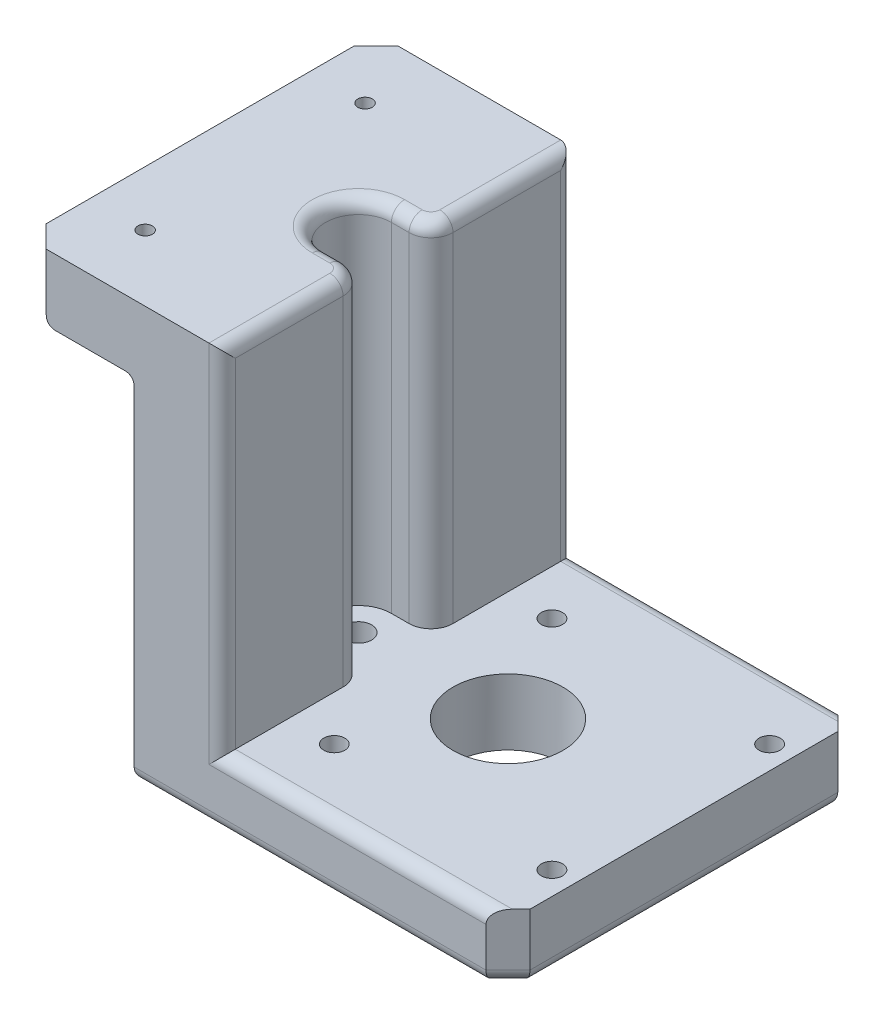
from build123d import *

# Parameters (mm, degrees)
SKETCH1_W           = 90
SKETCH1_H           = 80
BOSS_EXTRUDE1_DEPTH = 15
SKETCH2_R           = 7
CUT_EXTRUDE1_DEPTH  = 5
CHAMFER1_SIZE       = 5
SKETCH3_R           = 2.4
SKETCH3_R_2         = 12.5
SKETCH3_R_3         = 4.25
CUT_EXTRUDE2_DEPTH  = 20
SKETCH4_R           = 6.23126099
SKETCH4_R_2         = 3
BOSS_EXTRUDE2_DEPTH = 10
BOSS_EXTRUDE3_DEPTH = 60
SKETCH6_R           = 1.65
BOSS_EXTRUDE4_DEPTH = 20
CHAMFER2_SIZE       = 5
FILLET1_R           = 3


with BuildPart() as part:
    # Sketch1 → Boss-Extrude1 (new body)
    with BuildSketch(Plane(origin=(0, 0, 0), x_dir=(1, 0, 0), z_dir=(0, 1, 0))):
        with Locations((45, 40)):
            Rectangle(SKETCH1_W, SKETCH1_H)
    extrude(amount=BOSS_EXTRUDE1_DEPTH)

    # Sketch2 → Cut-Extrude1 (cut)
    with BuildSketch(Plane.XZ):
        with Locations(Location((16, -40, 0), (0, 0, 270))):
            Circle(SKETCH2_R)
    extrude(amount=-CUT_EXTRUDE1_DEPTH, mode=Mode.SUBTRACT)

    # Chamfer1
    chamfer1_edges = [part.edges().sort_by_distance(p)[0] for p in [
        (0, 7.5, -80),
        (90, 7.5, -80),
        (90, 7.5, 0),
        (0, 7.5, 0),
    ]]
    chamfer(chamfer1_edges, length=CHAMFER1_SIZE)

    # Sketch3 → Cut-Extrude2 (cut)
    with BuildSketch(Plane(origin=(0, 15, 0), x_dir=(1, 0, 0), z_dir=(0, 1, 0))):
        with Locations(Location((35.251262658, 64.748737342, 0), (0, 0, 270))):
            Circle(SKETCH3_R)
        with Locations(Location((84.748737342, 64.748737342, 0), (0, 0, 90))):
            Circle(SKETCH3_R)
        with Locations(Location((84.748737342, 15.251262658, 0), (0, 0, 270))):
            Circle(SKETCH3_R)
        with Locations(Location((35.251262658, 15.251262658, 0), (0, 0, 90))):
            Circle(SKETCH3_R)
        with Locations(Location((50, 40, 0), (0, 0, 270))):
            Circle(SKETCH3_R_2)
        with Locations(Location((16, 40, 0), (0, 0, 270))):
            Circle(SKETCH3_R_3)
    extrude(amount=-CUT_EXTRUDE2_DEPTH, mode=Mode.SUBTRACT)

    # Sketch4 → Boss-Extrude2 (add)
    with BuildSketch(Plane(origin=(0, 15, 0), x_dir=(1, 0, 0), z_dir=(0, 1, 0))):
        with Locations((16, 40)):
            Circle(SKETCH4_R)
        with Locations(Location((16, 40, 0), (0, 0, 270))):
            Circle(SKETCH4_R_2, mode=Mode.SUBTRACT)
    extrude(amount=-BOSS_EXTRUDE2_DEPTH)

    # Sketch5 → Boss-Extrude3 (add)
    with BuildSketch(Plane(origin=(0, 15, 0), x_dir=(1, 0, 0), z_dir=(0, 1, 0))):
        with BuildLine():
            Line((5, 0), (25, 0))
            Line((25, 0), (25, 27.5))
            ThreePointArc((25, 27.5), (23.535533906, 31.035533906), (20, 32.5))
            Line((20, 32.5), (16, 32.5))
            ThreePointArc((16, 32.5), (8.5, 40), (16, 47.5))
            Line((16, 47.5), (20, 47.5))
            ThreePointArc((20, 47.5), (23.535533906, 48.964466094), (25, 52.5))
            Line((25, 52.5), (25, 80))
            Line((25, 80), (5, 80))
            Line((5, 80), (0, 75))
            Line((0, 75), (0, 5))
            Line((0, 5), (5, 0))
        make_face()
    extrude(amount=BOSS_EXTRUDE3_DEPTH)

    # Sketch6 → Boss-Extrude4 (add)
    with BuildSketch(Plane(origin=(0, 75, 0), x_dir=(1, 0, 0), z_dir=(0, 1, 0))):
        with BuildLine():
            Line((5, 80), (-20, 80))
            Line((-20, 80), (-20, 0))
            Line((-20, 0), (5, 0))
            Line((5, 0), (25, 0))
            Line((25, 0), (25, 27.5))
            ThreePointArc((25, 27.5), (23.535533906, 31.035533906), (20, 32.5))
            Line((20, 32.5), (16, 32.5))
            ThreePointArc((16, 32.5), (8.5, 40), (16, 47.5))
            Line((16, 47.5), (20, 47.5))
            ThreePointArc((20, 47.5), (23.535533906, 48.964466094), (25, 52.5))
            Line((25, 52.5), (25, 80))
            Line((25, 80), (5, 80))
        make_face()
        with Locations(Location((-7.5, 65, 0), (0, 0, 270))):
            Circle(SKETCH6_R, mode=Mode.SUBTRACT)
        with Locations(Location((-7.5, 15, 0), (0, 0, 270))):
            Circle(SKETCH6_R, mode=Mode.SUBTRACT)
    extrude(amount=BOSS_EXTRUDE4_DEPTH)

    # Chamfer2
    chamfer2_edges = [part.edges().sort_by_distance(p)[0] for p in [
        (-20, 85, 0),
        (-7.5, 75, 0),
        (-20, 85, -80),
        (-7.5, 75, -80),
    ]]
    chamfer(chamfer2_edges, length=CHAMFER2_SIZE)

    # Fillet1
    # the kernel refuses this fillet: 3 mm, written as the material it adds along each edge
    with BuildSketch(Plane(origin=(7.5, 82.5, 2.5), x_dir=(-0.816496580927726, 0.40824829046386135, 0.4082482904638647), z_dir=(-0.5773502691896258, -0.5773502691896258, -0.5773502691896258))) as fillet1_piece_1_section:
        with BuildLine():
            CenterArc((FILLET1_R * 0.57735026919, -FILLET1_R), FILLET1_R, 90, 60)
            Line((-FILLET1_R * 0.288675134595, -FILLET1_R * 0.5), (0, 0))
            Line((0, 0), (FILLET1_R * 0.57735026919, 0))
        make_face()
    fillet1_piece_1 = extrude(amount=17.320508076, mode=Mode.PRIVATE)
    fillet1_piece_1 = split(fillet1_piece_1, bisect_by=Plane(origin=(2.443536035, 77.443536035, 0), z_dir=(0, 0, -1)), keep=Keep.TOP, mode=Mode.PRIVATE)
    fillet1_piece_1 = split(fillet1_piece_1, bisect_by=Plane(origin=(0, 77.443536035, -2.121242245), z_dir=(1, 0, 0)), keep=Keep.TOP, mode=Mode.PRIVATE)
    fillet1_piece_1 = split(fillet1_piece_1, bisect_by=Plane(origin=(2.443536035, 75, -2.121242245), z_dir=(0, 1, 0)), keep=Keep.TOP, mode=Mode.PRIVATE)
    add(fillet1_piece_1)
    with BuildSketch(Plane(origin=(7.5, 82.5, 2.5), x_dir=(-0.816496580927726, 0.40824829046386135, 0.4082482904638647), z_dir=(-0.5773502691896258, -0.5773502691896258, -0.5773502691896258))) as fillet1_piece_2_section:
        with BuildLine():
            CenterArc((FILLET1_R * 0.57735026919, -FILLET1_R), FILLET1_R, 90, 60)
            Line((-FILLET1_R * 0.288675134595, -FILLET1_R * 0.5), (0, 0))
            Line((0, 0), (FILLET1_R * 0.57735026919, 0))
        make_face()
    fillet1_piece_2 = extrude(amount=17.320508076, mode=Mode.PRIVATE)
    fillet1_piece_2 = split(fillet1_piece_2, bisect_by=Plane(origin=(0, 74.437654686, -4.39441922), z_dir=(1, 0, 0)), keep=Keep.TOP, mode=Mode.PRIVATE)
    fillet1_piece_2 = split(fillet1_piece_2, bisect_by=Plane(origin=(0.562345314, 75, -4.39441922), z_dir=(0, -1, 0)), keep=Keep.TOP, mode=Mode.PRIVATE)
    add(fillet1_piece_2)
    with BuildSketch(Plane(origin=(7.5, 82.5, 2.5), x_dir=(-0.816496580927726, 0.40824829046386135, 0.4082482904638647), z_dir=(-0.5773502691896258, -0.5773502691896258, -0.5773502691896258))) as fillet1_piece_3_section:
        with BuildLine():
            CenterArc((FILLET1_R * 0.57735026919, -FILLET1_R), FILLET1_R, 90, 60)
            Line((-FILLET1_R * 0.288675134595, -FILLET1_R * 0.5), (0, 0))
            Line((0, 0), (FILLET1_R * 0.57735026919, 0))
        make_face()
    fillet1_piece_3 = extrude(amount=17.320508076, mode=Mode.PRIVATE)
    fillet1_piece_3 = split(fillet1_piece_3, bisect_by=Plane(origin=(0, 75.562345314, -4.39441922), z_dir=(-1, 0, 0)), keep=Keep.TOP, mode=Mode.PRIVATE)
    fillet1_piece_3 = split(fillet1_piece_3, bisect_by=Plane(origin=(-0.562345314, 75, -4.39441922), z_dir=(0, 1, 0)), keep=Keep.TOP, mode=Mode.PRIVATE)
    add(fillet1_piece_3)
    with BuildSketch(Plane(origin=(7.5, 82.5, -82.5), x_dir=(0.40824829046386274, -0.816496580927726, -0.40824829046386324), z_dir=(-0.5773502691896258, -0.5773502691896258, 0.5773502691896258))) as fillet1_piece_4_section:
        with BuildLine():
            CenterArc((FILLET1_R * 0.57735026919, -FILLET1_R), FILLET1_R, 90, 60)
            Line((-FILLET1_R * 0.288675134595, -FILLET1_R * 0.5), (0, 0))
            Line((0, 0), (FILLET1_R * 0.57735026919, 0))
        make_face()
    fillet1_piece_4 = extrude(amount=17.320508076, mode=Mode.PRIVATE)
    fillet1_piece_4 = split(fillet1_piece_4, bisect_by=Plane(origin=(2.443536035, 77.443536035, -80), z_dir=(0, 0, 1)), keep=Keep.TOP, mode=Mode.PRIVATE)
    fillet1_piece_4 = split(fillet1_piece_4, bisect_by=Plane(origin=(0, 77.443536035, -77.878757755), z_dir=(1, 0, 0)), keep=Keep.TOP, mode=Mode.PRIVATE)
    fillet1_piece_4 = split(fillet1_piece_4, bisect_by=Plane(origin=(2.443536035, 75, -77.878757755), z_dir=(0, 1, 0)), keep=Keep.TOP, mode=Mode.PRIVATE)
    add(fillet1_piece_4)
    with BuildSketch(Plane(origin=(7.5, 82.5, -82.5), x_dir=(0.40824829046386274, -0.816496580927726, -0.40824829046386324), z_dir=(-0.5773502691896258, -0.5773502691896258, 0.5773502691896258))) as fillet1_piece_5_section:
        with BuildLine():
            CenterArc((FILLET1_R * 0.57735026919, -FILLET1_R), FILLET1_R, 90, 60)
            Line((-FILLET1_R * 0.288675134595, -FILLET1_R * 0.5), (0, 0))
            Line((0, 0), (FILLET1_R * 0.57735026919, 0))
        make_face()
    fillet1_piece_5 = extrude(amount=17.320508076, mode=Mode.PRIVATE)
    fillet1_piece_5 = split(fillet1_piece_5, bisect_by=Plane(origin=(0, 75.562345314, -75.60558078), z_dir=(-1, 0, 0)), keep=Keep.TOP, mode=Mode.PRIVATE)
    fillet1_piece_5 = split(fillet1_piece_5, bisect_by=Plane(origin=(-0.562345314, 75, -75.60558078), z_dir=(0, 1, 0)), keep=Keep.TOP, mode=Mode.PRIVATE)
    add(fillet1_piece_5)
    with BuildSketch(Plane(origin=(7.5, 82.5, -82.5), x_dir=(0.40824829046386274, -0.816496580927726, -0.40824829046386324), z_dir=(-0.5773502691896258, -0.5773502691896258, 0.5773502691896258))) as fillet1_piece_6_section:
        with BuildLine():
            CenterArc((FILLET1_R * 0.57735026919, -FILLET1_R), FILLET1_R, 90, 60)
            Line((-FILLET1_R * 0.288675134595, -FILLET1_R * 0.5), (0, 0))
            Line((0, 0), (FILLET1_R * 0.57735026919, 0))
        make_face()
    fillet1_piece_6 = extrude(amount=17.320508076, mode=Mode.PRIVATE)
    fillet1_piece_6 = split(fillet1_piece_6, bisect_by=Plane(origin=(0, 74.437654686, -75.60558078), z_dir=(1, 0, 0)), keep=Keep.TOP, mode=Mode.PRIVATE)
    fillet1_piece_6 = split(fillet1_piece_6, bisect_by=Plane(origin=(0.562345314, 75, -75.60558078), z_dir=(0, -1, 0)), keep=Keep.TOP, mode=Mode.PRIVATE)
    add(fillet1_piece_6)
    with BuildSketch(Plane(origin=(0, 75, -82.5), x_dir=(0, -1, 0), z_dir=(0, 0, 1))) as fillet1_piece_7_section:
        with BuildLine():
            CenterArc((FILLET1_R, -FILLET1_R), FILLET1_R, 90, 90)
            Line((0, -FILLET1_R), (0, 0))
            Line((0, 0), (FILLET1_R, 0))
        make_face()
    fillet1_piece_7 = extrude(amount=85, mode=Mode.PRIVATE)
    fillet1_piece_7 = split(fillet1_piece_7, bisect_by=Plane(origin=(-1.222323404, 74.871054126, -73.777676596), z_dir=(-0.7071067811865476, 0, -0.7071067811865476)), keep=Keep.TOP, mode=Mode.PRIVATE)
    fillet1_piece_7 = split(fillet1_piece_7, bisect_by=Plane(origin=(-1.586782581, 74.506594949, -74.506594949), z_dir=(0, 0.7071067811865476, 0.7071067811865476)), keep=Keep.TOP, mode=Mode.PRIVATE)
    add(fillet1_piece_7)
    with BuildSketch(Plane(origin=(0, 75, -82.5), x_dir=(0, -1, 0), z_dir=(0, 0, 1))) as fillet1_piece_8_section:
        with BuildLine():
            CenterArc((FILLET1_R, -FILLET1_R), FILLET1_R, 90, 90)
            Line((0, -FILLET1_R), (0, 0))
            Line((0, 0), (FILLET1_R, 0))
        make_face()
    fillet1_piece_8 = extrude(amount=85, mode=Mode.PRIVATE)
    fillet1_piece_8 = split(fillet1_piece_8, bisect_by=Plane(origin=(-0.493405051, 73.413217419, -74.506594949), z_dir=(0.7071067811865476, 0, 0.7071067811865476)), keep=Keep.TOP, mode=Mode.PRIVATE)
    fillet1_piece_8 = split(fillet1_piece_8, bisect_by=Plane(origin=(-0.128945874, 73.777676596, -73.777676596), z_dir=(0, -0.7071067811865476, -0.7071067811865476)), keep=Keep.TOP, mode=Mode.PRIVATE)
    add(fillet1_piece_8)
    with BuildSketch(Plane(origin=(0, 75, -82.5), x_dir=(0, -1, 0), z_dir=(0, 0, 1))) as fillet1_piece_9_section:
        with BuildLine():
            CenterArc((FILLET1_R, -FILLET1_R), FILLET1_R, 90, 90)
            Line((0, -FILLET1_R), (0, 0))
            Line((0, 0), (FILLET1_R, 0))
        make_face()
    fillet1_piece_9 = extrude(amount=85, mode=Mode.PRIVATE)
    fillet1_piece_9 = split(fillet1_piece_9, bisect_by=Plane(origin=(-17.837124827, 74.325750345, -57.162875173), z_dir=(0.7071067811865476, 0, 0.7071067811865476)), keep=Keep.TOP, mode=Mode.PRIVATE)
    fillet1_piece_9 = split(fillet1_piece_9, bisect_by=Plane(origin=(-17.837124827, 74.325750345, -22.837124827), z_dir=(0.7071067811865476, 0, -0.7071067811865476)), keep=Keep.TOP, mode=Mode.PRIVATE)
    fillet1_piece_9 = split(fillet1_piece_9, bisect_by=Plane(origin=(-0.674249655, 57.162875173, -57.162875173), z_dir=(0, 0.7071067811865476, 0.7071067811865476)), keep=Keep.TOP, mode=Mode.PRIVATE)
    fillet1_piece_9 = split(fillet1_piece_9, bisect_by=Plane(origin=(-0.674249655, 57.162875173, -22.837124827), z_dir=(0, 0.7071067811865476, -0.7071067811865476)), keep=Keep.TOP, mode=Mode.PRIVATE)
    add(fillet1_piece_9)
    with BuildSketch(Plane(origin=(0, 75, -82.5), x_dir=(0, -1, 0), z_dir=(0, 0, 1))) as fillet1_piece_10_section:
        with BuildLine():
            CenterArc((FILLET1_R, -FILLET1_R), FILLET1_R, 90, 90)
            Line((0, -FILLET1_R), (0, 0))
            Line((0, 0), (FILLET1_R, 0))
        make_face()
    fillet1_piece_10 = extrude(amount=85, mode=Mode.PRIVATE)
    fillet1_piece_10 = split(fillet1_piece_10, bisect_by=Plane(origin=(-1.222323404, 74.871054126, -6.222323404), z_dir=(-0.7071067811865476, 0, 0.7071067811865476)), keep=Keep.TOP, mode=Mode.PRIVATE)
    fillet1_piece_10 = split(fillet1_piece_10, bisect_by=Plane(origin=(-1.586782581, 74.506594949, -5.493405051), z_dir=(0, 0.7071067811865476, -0.7071067811865476)), keep=Keep.TOP, mode=Mode.PRIVATE)
    add(fillet1_piece_10)
    with BuildSketch(Plane(origin=(0, 75, -82.5), x_dir=(0, -1, 0), z_dir=(0, 0, 1))) as fillet1_piece_11_section:
        with BuildLine():
            CenterArc((FILLET1_R, -FILLET1_R), FILLET1_R, 90, 90)
            Line((0, -FILLET1_R), (0, 0))
            Line((0, 0), (FILLET1_R, 0))
        make_face()
    fillet1_piece_11 = extrude(amount=85, mode=Mode.PRIVATE)
    fillet1_piece_11 = split(fillet1_piece_11, bisect_by=Plane(origin=(-0.493405051, 73.413217419, -5.493405051), z_dir=(0.7071067811865476, 0, -0.7071067811865476)), keep=Keep.TOP, mode=Mode.PRIVATE)
    fillet1_piece_11 = split(fillet1_piece_11, bisect_by=Plane(origin=(-0.128945874, 73.777676596, -6.222323404), z_dir=(0, -0.7071067811865476, 0.7071067811865476)), keep=Keep.TOP, mode=Mode.PRIVATE)
    add(fillet1_piece_11)
    with BuildSketch(Plane(origin=(0, 75, -82.5), x_dir=(0, -1, 0), z_dir=(0, 0, 1))) as fillet1_piece_12a_section:
        with BuildLine():
            CenterArc((FILLET1_R, -FILLET1_R), FILLET1_R, 90, 90)
            Line((0, -FILLET1_R), (0, 0))
            Line((0, 0), (FILLET1_R, 0))
        make_face()
    fillet1_piece_12a = extrude(amount=85, mode=Mode.PRIVATE)
    fillet1_piece_12a = split(fillet1_piece_12a, bisect_by=Plane(origin=(1.47794047, 74.320292137, -3.52205953), z_dir=(-0.7071067811865476, 0, 0.7071067811865476)), keep=Keep.TOP, mode=Mode.PRIVATE)
    fillet1_piece_12a = split(fillet1_piece_12a, bisect_by=Plane(origin=(-0.679707863, 76.47794047, -3.52205953), z_dir=(0, -0.7071067811865476, 0.7071067811865476)), keep=Keep.TOP, mode=Mode.PRIVATE)
    with BuildSketch(Plane(origin=(7.5, 82.5, 2.5), x_dir=(-0.816496580927726, 0.40824829046386135, 0.4082482904638647), z_dir=(-0.5773502691896258, -0.5773502691896258, -0.5773502691896258))) as fillet1_piece_12b_section:
        with BuildLine():
            CenterArc((FILLET1_R * 0.57735026919, -FILLET1_R), FILLET1_R, 90, 60)
            Line((-FILLET1_R * 0.288675134595, -FILLET1_R * 0.5), (0, 0))
            Line((0, 0), (FILLET1_R * 0.57735026919, 0))
        make_face()
    fillet1_piece_12b = extrude(amount=17.320508076, mode=Mode.PRIVATE)
    fillet1_piece_12b = split(fillet1_piece_12b, bisect_by=Plane(origin=(0, 73.512134225, -6.043248673), z_dir=(-1, 0, 0)), keep=Keep.TOP, mode=Mode.PRIVATE)
    fillet1_piece_12b = split(fillet1_piece_12b, bisect_by=Plane(origin=(-1.487865775, 75, -6.043248673), z_dir=(0, -1, 0)), keep=Keep.TOP, mode=Mode.PRIVATE)
    fillet1_piece_12 = fillet1_piece_12a & fillet1_piece_12b
    add(fillet1_piece_12)
    with BuildSketch(Plane(origin=(7.5, 82.5, -82.5), x_dir=(0.40824829046386274, -0.816496580927726, -0.40824829046386324), z_dir=(-0.5773502691896258, -0.5773502691896258, 0.5773502691896258))) as fillet1_piece_13a_section:
        with BuildLine():
            CenterArc((FILLET1_R * 0.57735026919, -FILLET1_R), FILLET1_R, 90, 60)
            Line((-FILLET1_R * 0.288675134595, -FILLET1_R * 0.5), (0, 0))
            Line((0, 0), (FILLET1_R * 0.57735026919, 0))
        make_face()
    fillet1_piece_13a = extrude(amount=17.320508076, mode=Mode.PRIVATE)
    fillet1_piece_13a = split(fillet1_piece_13a, bisect_by=Plane(origin=(0, 73.512134225, -73.956751327), z_dir=(-1, 0, 0)), keep=Keep.TOP, mode=Mode.PRIVATE)
    fillet1_piece_13a = split(fillet1_piece_13a, bisect_by=Plane(origin=(-1.487865775, 75, -73.956751327), z_dir=(0, -1, 0)), keep=Keep.TOP, mode=Mode.PRIVATE)
    with BuildSketch(Plane(origin=(0, 75, -82.5), x_dir=(0, -1, 0), z_dir=(0, 0, 1))) as fillet1_piece_13b_section:
        with BuildLine():
            CenterArc((FILLET1_R, -FILLET1_R), FILLET1_R, 90, 90)
            Line((0, -FILLET1_R), (0, 0))
            Line((0, 0), (FILLET1_R, 0))
        make_face()
    fillet1_piece_13b = extrude(amount=85, mode=Mode.PRIVATE)
    fillet1_piece_13b = split(fillet1_piece_13b, bisect_by=Plane(origin=(1.47794047, 74.320292137, -76.47794047), z_dir=(-0.7071067811865476, 0, -0.7071067811865476)), keep=Keep.TOP, mode=Mode.PRIVATE)
    fillet1_piece_13b = split(fillet1_piece_13b, bisect_by=Plane(origin=(-0.679707863, 76.47794047, -76.47794047), z_dir=(0, -0.7071067811865476, -0.7071067811865476)), keep=Keep.TOP, mode=Mode.PRIVATE)
    fillet1_piece_13 = fillet1_piece_13a & fillet1_piece_13b
    add(fillet1_piece_13)
    # the kernel refuses this fillet: 3 mm, written as the material it takes off along each edge
    with BuildSketch(Plane(origin=(25, 95, 7.5), x_dir=(0, -1, 0), z_dir=(0, 0, -1)), Plane(origin=(25, 95, -52.5), x_dir=(0, -1, 0), z_dir=(0, 0, -1))) as fillet1_2_piece_1:
        with BuildLine():
            CenterArc((FILLET1_R, FILLET1_R), FILLET1_R, 180, 90)
            Line((0, FILLET1_R), (0, 0))
            Line((0, 0), (FILLET1_R, 0))
        make_face()
    extrude(amount=35, mode=Mode.SUBTRACT)
    with BuildSketch(Plane(origin=(20, 95, -27.5), x_dir=(1, 0, 0), z_dir=(0, 0, 1))) as fillet1_2_piece_2:
        with BuildLine():
            CenterArc((5 - FILLET1_R, -FILLET1_R), FILLET1_R, 0, 90)
            Line((5 - FILLET1_R, 0), (5, 0))
            Line((5, 0), (5, -FILLET1_R))
        make_face()
    revolve(axis=Axis((20, 95, -27.5), (0, 1, 0)), revolution_arc=90, mode=Mode.SUBTRACT)
    with BuildSketch(Plane(origin=(20, 95, -32.5), x_dir=(0, -1, 0), z_dir=(-1, 0, 0)), Plane(origin=(16, 95, -47.5), x_dir=(0, -1, 0), z_dir=(1, 0, 0))) as fillet1_2_piece_3:
        with BuildLine():
            CenterArc((FILLET1_R, FILLET1_R), FILLET1_R, 180, 90)
            Line((0, FILLET1_R), (0, 0))
            Line((0, 0), (FILLET1_R, 0))
        make_face()
    extrude(amount=4, mode=Mode.SUBTRACT)
    with BuildSketch(Plane(origin=(16, 95, -40), x_dir=(0, 0, 1), z_dir=(1, 0, 0))) as fillet1_2_piece_4:
        with BuildLine():
            CenterArc((7.5 + FILLET1_R, FILLET1_R), FILLET1_R, 180, 90)
            Line((7.5 + FILLET1_R, 0), (7.5, 0))
            Line((7.5, 0), (7.5, FILLET1_R))
        make_face()
    revolve(axis=Axis((16, 95, -40), (0, -1, 0)), revolution_arc=180, mode=Mode.SUBTRACT)
    with BuildSketch(Plane(origin=(20, 95, -52.5), x_dir=(0, 0, 1), z_dir=(-1, 0, 0))) as fillet1_2_piece_5:
        with BuildLine():
            CenterArc((5 - FILLET1_R, -FILLET1_R), FILLET1_R, 0, 90)
            Line((5 - FILLET1_R, 0), (5, 0))
            Line((5, 0), (5, -FILLET1_R))
        make_face()
    revolve(axis=Axis((20, 95, -52.5), (0, 1, 0)), revolution_arc=90, mode=Mode.SUBTRACT)
    with BuildSketch(Plane(origin=(-20, 75, -82.5), x_dir=(0, 1, 0), z_dir=(0, 0, 1)), Plane(origin=(0, 0, -82.5), x_dir=(0, 1, 0), z_dir=(0, 0, 1)), Plane(origin=(90, 0, 2.5), x_dir=(0, 1, 0), z_dir=(0, 0, -1))) as fillet1_2_piece_6:
        with BuildLine():
            CenterArc((FILLET1_R, -FILLET1_R), FILLET1_R, 90, 90)
            Line((0, -FILLET1_R), (0, 0))
            Line((0, 0), (FILLET1_R, 0))
        make_face()
    extrude(amount=85, mode=Mode.SUBTRACT)
    with BuildSketch(Plane(origin=(-12.5, 82.5, 2.5), x_dir=(-0.4082482904638625, 0.8164965809277261, -0.4082482904638636), z_dir=(-0.5773502691896258, -0.5773502691896258, -0.5773502691896258))) as fillet1_2_piece_7:
        with BuildLine():
            CenterArc((FILLET1_R * 0.57735026919, FILLET1_R), FILLET1_R, 210, 60)
            Line((-FILLET1_R * 0.288675134595, FILLET1_R * 0.5), (0, 0))
            Line((0, 0), (FILLET1_R * 0.57735026919, 0))
        make_face()
    extrude(amount=17.320508076, mode=Mode.SUBTRACT)
    with BuildSketch(Plane(origin=(-12.5, 82.5, -82.5), x_dir=(-0.40824829046386046, 0.816496580927726, 0.40824829046386557), z_dir=(-0.5773502691896258, -0.5773502691896258, 0.5773502691896258))) as fillet1_2_piece_8:
        with BuildLine():
            CenterArc((FILLET1_R * 0.57735026919, -FILLET1_R), FILLET1_R, 90, 60)
            Line((-FILLET1_R * 0.288675134595, -FILLET1_R * 0.5), (0, 0))
            Line((0, 0), (FILLET1_R * 0.57735026919, 0))
        make_face()
    extrude(amount=17.320508076, mode=Mode.SUBTRACT)
    with BuildSketch(Plane(origin=(92.5, 0, -80), x_dir=(0, 1, 0), z_dir=(-1, 0, 0)), Plane(origin=(-2.5, 0, 0), x_dir=(0, 1, 0), z_dir=(1, 0, 0))) as fillet1_2_piece_9:
        with BuildLine():
            CenterArc((FILLET1_R, -FILLET1_R), FILLET1_R, 90, 90)
            Line((0, -FILLET1_R), (0, 0))
            Line((0, 0), (FILLET1_R, 0))
        make_face()
    extrude(amount=95, mode=Mode.SUBTRACT)
    with BuildSketch(Plane(origin=(92.5, 15, -80), x_dir=(0, -1, 0), z_dir=(-1, 0, 0)), Plane(origin=(25, 15, 0), x_dir=(0, -1, 0), z_dir=(1, 0, 0))) as fillet1_2_piece_10:
        with BuildLine():
            CenterArc((FILLET1_R, FILLET1_R), FILLET1_R, 180, 90)
            Line((0, FILLET1_R), (0, 0))
            Line((0, 0), (FILLET1_R, 0))
        make_face()
    extrude(amount=67.5, mode=Mode.SUBTRACT)
    with BuildSketch(Plane(origin=(10.303300859, 0, 5.303300859), x_dir=(0, 1, 0), z_dir=(-0.7071067811865476, 0, -0.7071067811865476)), Plane(origin=(79.696699141, 0, 5.303300859), x_dir=(-0.7071067811865476, 0, -0.7071067811865476), z_dir=(0.7071067811865476, 0, -0.7071067811865476)), Plane(origin=(-5.303300859, 0, -69.696699141), x_dir=(0, 1, 0), z_dir=(0.7071067811865476, 0, -0.7071067811865476))) as fillet1_2_piece_11:
        with BuildLine():
            CenterArc((FILLET1_R, FILLET1_R), FILLET1_R, 180, 90)
            Line((0, FILLET1_R), (0, 0))
            Line((0, 0), (FILLET1_R, 0))
        make_face()
    extrude(amount=22.071067812, mode=Mode.SUBTRACT)
    with BuildSketch(Plane(origin=(95.303300859, 0, -69.696699141), x_dir=(0, 1, 0), z_dir=(-0.7071067811865476, 0, -0.7071067811865476))) as fillet1_2_piece_12:
        with BuildLine():
            CenterArc((FILLET1_R, -FILLET1_R), FILLET1_R, 90, 90)
            Line((0, -FILLET1_R), (0, 0))
            Line((0, 0), (FILLET1_R, 0))
        make_face()
    extrude(amount=22.071067812, mode=Mode.SUBTRACT)
    with BuildSketch(Plane(origin=(25, 15, 0), x_dir=(-1, 0, 0), z_dir=(0, 1, 0)), Plane(origin=(25, 102.5, -80), x_dir=(-1, 0, 0), z_dir=(0, -1, 0))) as fillet1_2_piece_13:
        with BuildLine():
            CenterArc((FILLET1_R, -FILLET1_R), FILLET1_R, 90, 90)
            Line((0, -FILLET1_R), (0, 0))
            Line((0, 0), (FILLET1_R, 0))
        make_face()
    extrude(amount=87.5, mode=Mode.SUBTRACT)
    with BuildSketch(Plane(origin=(92.5, 15, -80), x_dir=(0, -1, 0), z_dir=(-1, 0, 0))) as fillet1_2_piece_14a_section:
        with BuildLine():
            CenterArc((FILLET1_R, FILLET1_R), FILLET1_R, 180, 90)
            Line((0, FILLET1_R), (0, 0))
            Line((0, 0), (FILLET1_R, 0))
        make_face()
    fillet1_2_piece_14a = extrude(amount=75, mode=Mode.PRIVATE)
    fillet1_2_piece_14a = split(fillet1_2_piece_14a, bisect_by=Plane(origin=(25, 14.320814657, -79.320814657), z_dir=(-1, 0, 0)), keep=Keep.TOP, mode=Mode.PRIVATE)
    with BuildSketch(Plane(origin=(25, 102.5, -80), x_dir=(-1, 0, 0), z_dir=(0, -1, 0))) as fillet1_2_piece_14b_section:
        with BuildLine():
            CenterArc((FILLET1_R, -FILLET1_R), FILLET1_R, 90, 90)
            Line((0, -FILLET1_R), (0, 0))
            Line((0, 0), (FILLET1_R, 0))
        make_face()
    fillet1_2_piece_14b = extrude(amount=95, mode=Mode.PRIVATE)
    fillet1_2_piece_14b = split(fillet1_2_piece_14b, bisect_by=Plane(origin=(24.320814657, 15, -79.320814657), z_dir=(0, -1, 0)), keep=Keep.TOP, mode=Mode.PRIVATE)
    fillet1_2_piece_14 = fillet1_2_piece_14a & fillet1_2_piece_14b
    add(fillet1_2_piece_14, mode=Mode.SUBTRACT)
    with BuildSketch(Plane(origin=(25, 7.5, 0), x_dir=(-1, 0, 0), z_dir=(0, 1, 0))) as fillet1_2_piece_15a_section:
        with BuildLine():
            CenterArc((FILLET1_R, -FILLET1_R), FILLET1_R, 90, 90)
            Line((0, -FILLET1_R), (0, 0))
            Line((0, 0), (FILLET1_R, 0))
        make_face()
    fillet1_2_piece_15a = extrude(amount=95, mode=Mode.PRIVATE)
    fillet1_2_piece_15a = split(fillet1_2_piece_15a, bisect_by=Plane(origin=(24.320814657, 15, -0.679185343), z_dir=(0, -1, 0)), keep=Keep.TOP, mode=Mode.PRIVATE)
    with BuildSketch(Plane(origin=(17.5, 15, 0), x_dir=(0, -1, 0), z_dir=(1, 0, 0))) as fillet1_2_piece_15b_section:
        with BuildLine():
            CenterArc((FILLET1_R, FILLET1_R), FILLET1_R, 180, 90)
            Line((0, FILLET1_R), (0, 0))
            Line((0, 0), (FILLET1_R, 0))
        make_face()
    fillet1_2_piece_15b = extrude(amount=75, mode=Mode.PRIVATE)
    fillet1_2_piece_15b = split(fillet1_2_piece_15b, bisect_by=Plane(origin=(25, 14.320814657, -0.679185343), z_dir=(-1, 0, 0)), keep=Keep.TOP, mode=Mode.PRIVATE)
    fillet1_2_piece_15 = fillet1_2_piece_15a & fillet1_2_piece_15b
    add(fillet1_2_piece_15, mode=Mode.SUBTRACT)


solid = part.part
